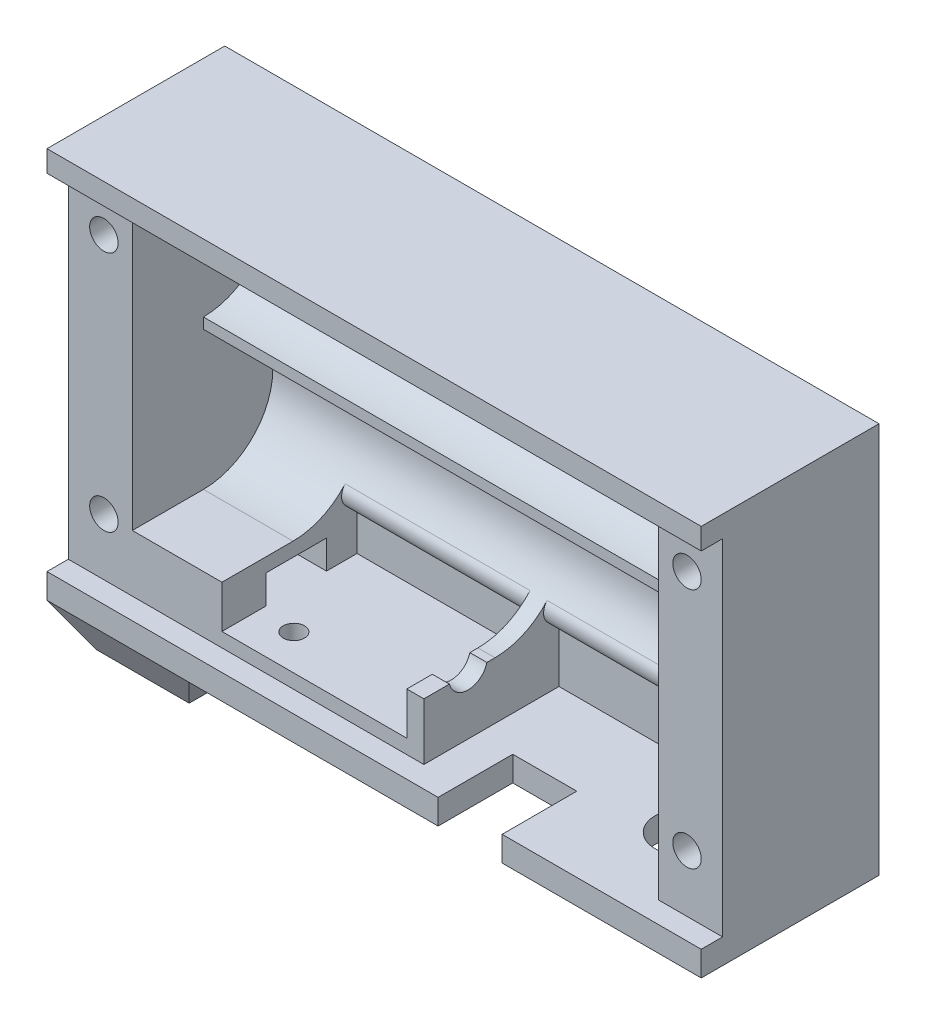
from build123d import *

# Parameters (mm, degrees)
SKETCH1_W            = 92
SKETCH1_H            = 55
BODY_DEPTH           = 25
BATTERY_DEPTH        = 37
SKETCH3_W            = 33
SKETCH3_H            = 8
CONTROLLER_DEPTH     = 22
CUT_EXTRUDE3_REACH   = 77.934
SKETCH4_R            = 4
CONNECTOR_REACH      = 77.934
SKETCH5_W            = 9
SKETCH5_H            = 10.5
SKETCH6_W            = 26
SKETCH6_H            = 6
CHARGER_DEPTH        = 22
CHGLED_REACH         = 77.934
SKETCH7_R            = 1.5
SKETCH8_W            = 20
SKETCH8_H            = 25
BOSS_EXTRUDE1_DEPTH  = 6
BOSS_EXTRUDE1_TAPER  = 30
SKETCH9_W            = 10
SKETCH9_H            = 14
CUT_EXTRUDE7_DEPTH   = 15
SKETCH10_W           = 8.515500197
SKETCH10_H           = 4.030526349
CUT_EXTRUDE8_DEPTH   = 15
SKETCH11_W           = 3
SKETCH11_H           = 48.5
CUT_EXTRUDE9_DEPTH   = 102.050729983
LPATTERN1_COUNT      = 2
LPATTERN1_PITCH      = 82
LPATTERN1_COUNT_DIR2 = 2
LPATTERN1_PITCH_DIR2 = 34
FILLET1_R            = 2
SKETCH14_R           = 2.730125357
CUT_EXTRUDE10_DEPTH  = 10


with BuildPart() as part:
    # Sketch1 → Body (new body)
    with BuildSketch(Plane.XY):
        Rectangle(SKETCH1_W, SKETCH1_H)
    extrude(amount=BODY_DEPTH)

    # Sketch2 → Battery (cut, symmetric)
    with BuildSketch(Plane(origin=(0, 0, 0), x_dir=(0, 0, -1), z_dir=(1, 0, 0))):
        with BuildLine():
            Line((-12, 3.5), (-12, 5))
            ThreePointArc((-12, 5), (-2.25, 14.75), (-12, 24.5))
            Line((-12, 24.5), (-28.22158826, 24.5))
            Line((-28.22158826, 24.5), (-28.22158826, -16))
            Line((-28.22158826, -16), (-12, -16))
            ThreePointArc((-12, -16), (-2.25, -6.25), (-12, 3.5))
        make_face()
    extrude(amount=BATTERY_DEPTH, both=True, mode=Mode.SUBTRACT)

    # Sketch3 → Controller (cut)
    with BuildSketch(Plane.XY.offset(25)):
        with Locations((20.5, -20)):
            Rectangle(SKETCH3_W, SKETCH3_H)
    extrude(amount=-CONTROLLER_DEPTH, mode=Mode.SUBTRACT)

    # Sketch4 → Cut-Extrude3 (cut, up to next)
    with BuildSketch(Plane.XZ.offset(27.5), mode=Mode.PRIVATE) as cut_extrude3_sk1:
        with Locations((30.5, 12)):
            Circle(SKETCH4_R)
    cut_extrude3_tool1 = extrude(cut_extrude3_sk1.sketch, amount=-CUT_EXTRUDE3_REACH, mode=Mode.PRIVATE) & part.part
    add(cut_extrude3_tool1.solids().sort_by_distance((30.5, -27.5, 12))[0], mode=Mode.SUBTRACT)

    # Sketch5 → Connector (cut, up to next)
    with BuildSketch(Plane.XZ.offset(27.5), mode=Mode.PRIVATE) as connector_sk1:
        with Locations((13.5, 19.75)):
            Rectangle(SKETCH5_W, SKETCH5_H)
    connector_tool1 = extrude(connector_sk1.sketch, amount=-CONNECTOR_REACH, mode=Mode.PRIVATE) & part.part
    add(connector_tool1.solids().sort_by_distance((13.5, -27.5, 19.75))[0], mode=Mode.SUBTRACT)

    # Sketch6 → Charger (cut)
    with BuildSketch(Plane.XY.offset(25)):
        with Locations((-11.4, -19)):
            Rectangle(SKETCH6_W, SKETCH6_H)
    extrude(amount=-CHARGER_DEPTH, mode=Mode.SUBTRACT)

    # Sketch7 → ChgLED (cut, up to next)
    with BuildSketch(Plane(origin=(0, -27.5, 0), x_dir=(-1, 0, 0), z_dir=(0, -1, 0)), mode=Mode.PRIVATE) as chgled_sk1:
        with Locations((19.286360004, -17)):
            Circle(SKETCH7_R)
    chgled_tool1 = extrude(chgled_sk1.sketch, amount=-CHGLED_REACH, mode=Mode.PRIVATE) & part.part
    add(chgled_tool1.solids().sort_by_distance((-19.28636, -27.5, 17))[0], mode=Mode.SUBTRACT)

    # Sketch8 → Boss-Extrude1 (add)
    with BuildSketch(Plane.XZ.offset(27.5)):
        with Locations((-36, 12.5)):
            Rectangle(SKETCH8_W, SKETCH8_H)
    extrude(amount=BOSS_EXTRUDE1_DEPTH, taper=BOSS_EXTRUDE1_TAPER)

    # Sketch9 → Cut-Extrude7 (cut)
    with BuildSketch(Plane.XZ.offset(33.5)):
        with Locations((-36, 12.5)):
            Rectangle(SKETCH9_W, SKETCH9_H)
    extrude(amount=-CUT_EXTRUDE7_DEPTH, mode=Mode.SUBTRACT)

    # Sketch10 → Cut-Extrude8 (cut)
    with BuildSketch(Plane(origin=(-24.4, 0, 0), x_dir=(0, 0, -1), z_dir=(1, 0, 0))):
        with Locations((-11.554387417, -19.984736826)):
            Rectangle(SKETCH10_W, SKETCH10_H)
    extrude(amount=-CUT_EXTRUDE8_DEPTH, mode=Mode.SUBTRACT)

    # Sketch11 → Cut-Extrude9 (cut, through all)
    with BuildSketch(Plane(origin=(46, 0, 0), x_dir=(0, 0, -1), z_dir=(1, 0, 0))):
        with Locations((-23.5, 0.25)):
            Rectangle(SKETCH11_W, SKETCH11_H)
    extrude(amount=-CUT_EXTRUDE9_DEPTH, mode=Mode.SUBTRACT)

    # Sketch13 → Ø4.0mm Dowel Hole1 (revolve, cut)
    with BuildSketch(Plane(origin=(41, 18, 22), x_dir=(0, -1, 0), z_dir=(1, 0, 0))):
        Polygon((0, 0), (0, 16.201721238), (2, 15), (2, 0), align=None)
    f_4_0mm_dowel_hole1 = revolve(axis=Axis((41, 18, 28.35), (0, 0, -1)), mode=Mode.SUBTRACT)

    # LPattern1: 4.0mm Dowel Hole1 2 × 2
    with Locations(*[(-i * LPATTERN1_PITCH, -j * LPATTERN1_PITCH_DIR2, 0) for i in range(LPATTERN1_COUNT) for j in range(LPATTERN1_COUNT_DIR2) if (i, j) != (0, 0)]):
        add(f_4_0mm_dowel_hole1, mode=Mode.SUBTRACT)

    # Fillet1
    fillet1_edges = [part.edges().sort_by_distance(p)[0] for p in [
        (-11.4, -16, 12),
        (20.5, -16, 12),
    ]]
    fillet(fillet1_edges, radius=FILLET1_R)

    # Sketch14 → Cut-Extrude10 (cut)
    with BuildSketch(Plane(origin=(0, 0, 0), x_dir=(0, 0, -1), z_dir=(1, 0, 0))):
        with Locations((-15.777227018, -15.298336579)):
            Circle(SKETCH14_R)
    extrude(amount=CUT_EXTRUDE10_DEPTH, mode=Mode.SUBTRACT)


solid = part.part
